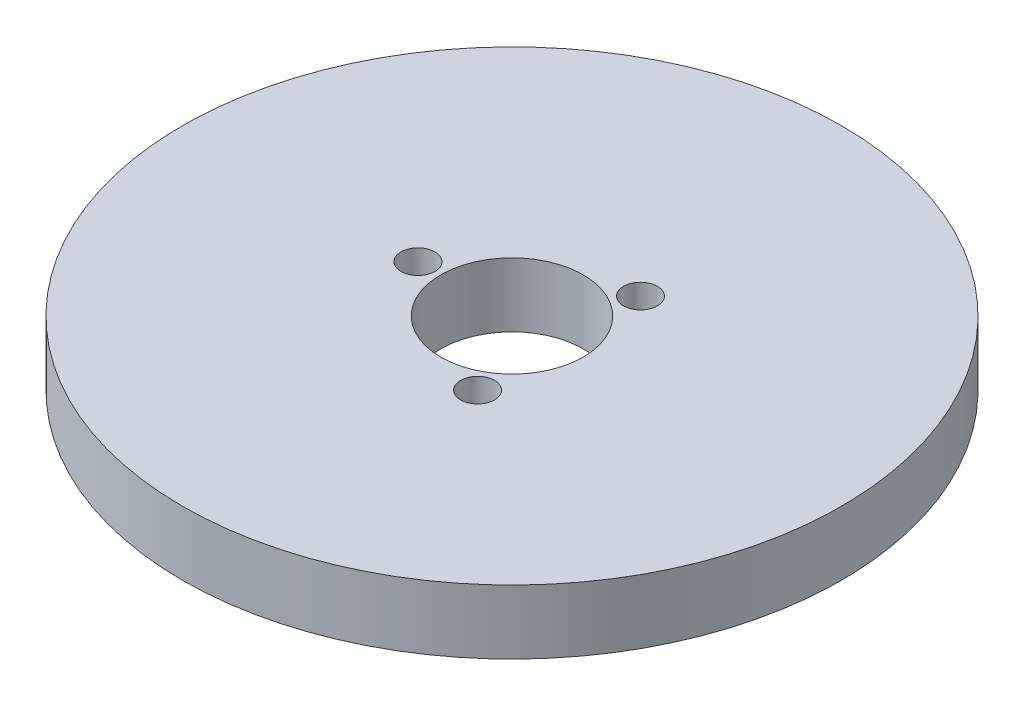
from build123d import *

# Parameters (mm, degrees)
SKETCH1_R           = 92.5
BOSS_EXTRUDE1_DEPTH = 18
SKETCH2_R           = 20
CUT_EXTRUDE1_DEPTH  = 133.047339996
SKETCH3_R           = 4.763062498
CUT_EXTRUDE2_DEPTH  = 17.758271805
CIRPATTERN1_COUNT   = 3


with BuildPart() as part:
    # Sketch1 → Boss-Extrude1 (new body)
    with BuildSketch(Plane(origin=(0, 0, 0), x_dir=(1, 0, 0), z_dir=(0, 1, 0))):
        Circle(SKETCH1_R)
    extrude(amount=BOSS_EXTRUDE1_DEPTH)

    # Sketch2 → Cut-Extrude1 (cut, through all)
    with BuildSketch(Plane(origin=(0, 0, 0), x_dir=(1, 0, 0), z_dir=(0, 1, 0))):
        Circle(SKETCH2_R)
    extrude(amount=CUT_EXTRUDE1_DEPTH, mode=Mode.SUBTRACT)

    # Sketch3 → Cut-Extrude2 (cut)
    with BuildSketch(Plane(origin=(0, 18, 0), x_dir=(1, 0, 0), z_dir=(0, 1, 0))):
        with Locations((-26.397784928, 0)):
            Circle(SKETCH3_R)
    cut_extrude2 = extrude(amount=-CUT_EXTRUDE2_DEPTH, mode=Mode.SUBTRACT)

    # CirPattern1: Cut-Extrude2 ×3 about axis
    cirpattern1_axis = Axis((0, 0, 0), (0, 1, 0))
    for i in range(1, CIRPATTERN1_COUNT):
        add(cut_extrude2.rotate(cirpattern1_axis, i * 360 / CIRPATTERN1_COUNT), mode=Mode.SUBTRACT)


solid = part.part
